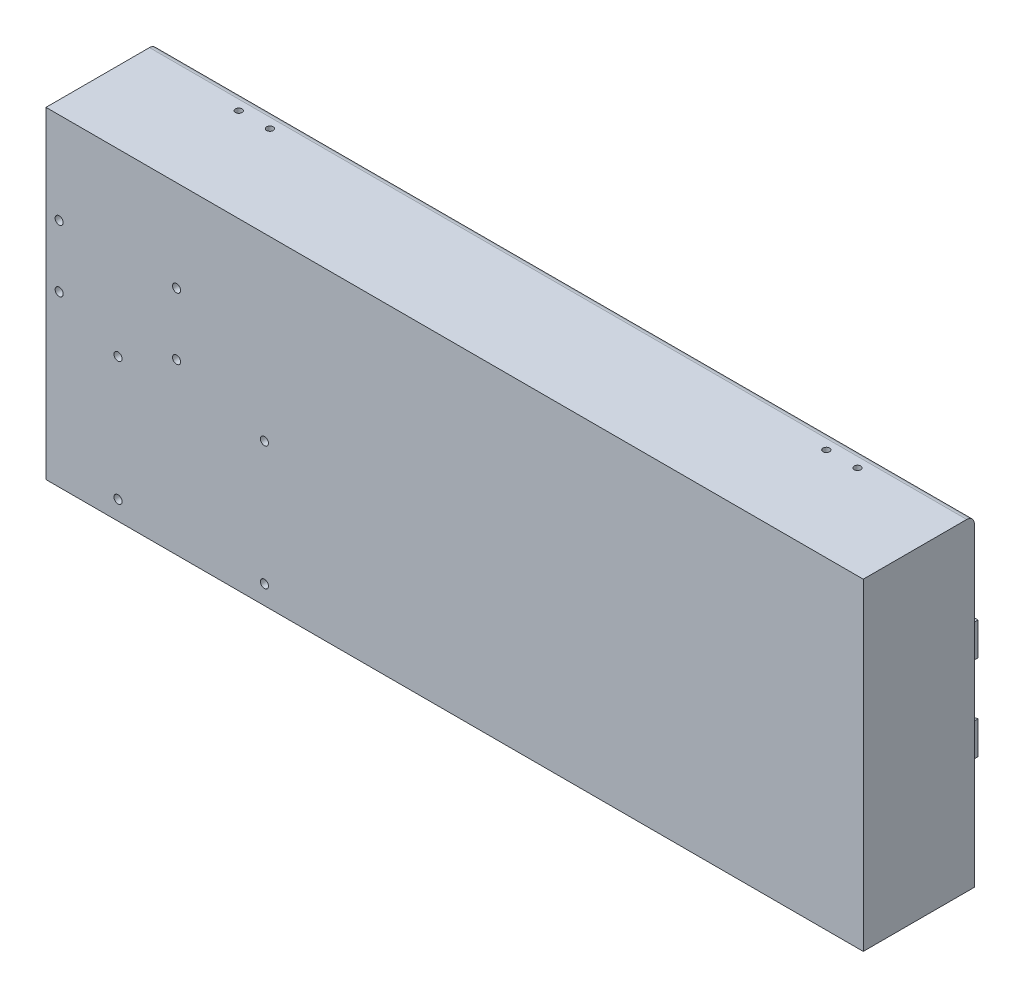
from build123d import *

# Parameters (mm, degrees)
SKETCH1_W               = 323.749339931
SKETCH1_H               = 127.712624425
BOSS_EXTRUDE1_DEPTH     = 4
SKETCH3_W               = 323.749339931
SKETCH3_H               = 127.712624425
SKETCH3_W_2             = 317.749339931
SKETCH3_H_2             = 121.712624425
BOSS_EXTRUDE2_DEPTH     = 40
BOSS_EXTRUDE4_DEPTH     = 23
MIRROR2_START           = -46
MIRROR2_DEPTH           = 46
SKETCH6_W               = 7
SKETCH6_H               = 7
SKETCH6_W_2             = 7.037117603
BOSS_EXTRUDE5_DEPTH     = 15
CUT_EXTRUDE1_DEPTH      = 384.171889741
CUT_EXTRUDE1_DEPTH_BACK = 384.171889741
SKETCH8_R               = 1.6
SKETCH15_W              = 16
SKETCH15_H              = 15.6321
SKETCH15_H_2            = 15.2842
SKETCH15_W_2            = 13.5
SKETCH15_H_3            = 15.875
CUT_EXTRUDE3_DEPTH      = 10
SKETCH20_W              = 6.961581082
SKETCH20_H              = 6.395810998
SKETCH20_W_2            = 15.273499614
SKETCH20_H_2            = 7.259028395
CUT_EXTRUDE5_DEPTH      = 15
SKETCH22_W              = 4
SKETCH22_H              = 4
BOSS_EXTRUDE7_DEPTH     = 15
CUT_EXTRUDE6_DEPTH      = 384.171889741
CUT_EXTRUDE6_DEPTH_BACK = 384.171889741
SKETCH23_R              = 1.6
SKETCH26_W              = 3.282490876
SKETCH26_H              = 7.57632074
CUT_EXTRUDE7_DEPTH      = 15
CUT_EXTRUDE9_DEPTH      = 384.171889741
CUT_EXTRUDE9_DEPTH_BACK = 10
SKETCH31_R              = 1.55
SKETCH35_R              = 1.29987
CUT_EXTRUDE10_DEPTH     = 6
FILLET1_R               = 3


# Read off the part's stored shape, not the designer's step: Mirror2
with BuildPart() as part:
    # Sketch1 → Boss-Extrude1 (new body)
    with BuildSketch(Plane.XY):
        with Locations((-196.446669966, 63.856312213)):
            Rectangle(SKETCH1_W, SKETCH1_H)
    extrude(amount=BOSS_EXTRUDE1_DEPTH)

    # Sketch3 → Boss-Extrude2 (add)
    with BuildSketch(Plane(origin=(0, 0, 0), x_dir=(-1, 0, 0), z_dir=(0, 0, -1))):
        with Locations((196.446669966, 63.856312213)):
            Rectangle(SKETCH3_W, SKETCH3_H)
        with Locations((196.446669966, 63.856312213)):
            Rectangle(SKETCH3_W_2, SKETCH3_H_2, mode=Mode.SUBTRACT)
    extrude(amount=BOSS_EXTRUDE2_DEPTH)

    # Sketch5 → Boss-Extrude4 (add)
    with BuildSketch(Plane(origin=(0, 0, 0), x_dir=(-1, 0, 0), z_dir=(0, 0, -1))):
        with BuildLine():
            Line((55.615, 15.55), (57.315, 15.55))
            Line((57.315, 15.55), (122.07188805, 15.55))
            Line((122.07188805, 15.55), (123.77188805, 15.55))
            Line((123.77188805, 15.55), (123.77188805, 39.55))
            Line((123.77188805, 39.55), (144.272, 39.55))
            Line((144.272, 39.55), (144.272, 52.55))
            ThreePointArc((144.272, 52.55), (118.055062242, 48.579333299), (91.572, 47.259699375))
            ThreePointArc((91.572, 47.259699375), (65.214565819, 48.591848157), (39.122, 52.55))
            Line((39.122, 52.55), (39.122, 39.55))
            Line((39.122, 39.55), (55.615, 39.55))
            Line((55.615, 39.55), (55.615, 15.55))
        make_face()
        with BuildLine():
            Line((122.07188805, 41.25), (122.07188805, 17.25))
            Line((122.07188805, 17.25), (57.315, 17.25))
            Line((57.315, 17.25), (57.315, 18.497962217))
            Line((57.315, 18.497962217), (57.315, 41.25))
            Line((57.315, 41.25), (40.822, 41.25))
            Line((40.822, 41.25), (40.822, 48.791098857))
            Line((40.822, 48.791098857), (40.822, 49.651849125))
            Line((40.822, 49.651849125), (40.822, 50.881098857))
            ThreePointArc((40.822, 50.881098857), (91.696923028, 45.880454534), (142.572, 50.879532423))
            Line((142.572, 50.879532423), (142.572, 48.791100773))
            Line((142.572, 48.791100773), (142.572, 42))
            Line((142.572, 42), (142.572, 41.25))
            Line((142.572, 41.25), (122.07188805, 41.25))
        make_face(mode=Mode.SUBTRACT)
    boss_extrude4 = extrude(amount=BOSS_EXTRUDE4_DEPTH)

    # Mirror1: Boss-Extrude4 across plane
    add(boss_extrude4.mirror(Plane.ZY.offset(149.272)))

    # Mirror2 outline → Mirror2 (add)
    # profile 1 of 4: a face of its own
    with BuildSketch(Plane.XY.offset(MIRROR2_START)):
        with BuildLine():
            Line((-144.272, 52.55), (-144.272, 39.55))
            Line((-144.272, 39.55), (-123.77188805, 39.55))
            Line((-123.77188805, 39.55), (-123.77188805, 15.55))
            Line((-123.77188805, 15.55), (-55.615, 15.55))
            Line((-55.615, 15.55), (-55.615, 39.55))
            Line((-55.615, 39.55), (-39.122, 39.55))
            Line((-39.122, 39.55), (-39.122, 52.55))
            ThreePointArc((-39.122, 52.55), (-91.697, 47.25966977), (-144.272, 52.55))
        make_face()
        with BuildLine():
            Line((-40.822, 41.25), (-57.315, 41.25))
            Line((-57.315, 41.25), (-57.315, 17.25))
            Line((-57.315, 17.25), (-122.07188805, 17.25))
            Line((-122.07188805, 17.25), (-122.07188805, 41.25))
            Line((-122.07188805, 41.25), (-142.572, 41.25))
            Line((-142.572, 41.25), (-142.572, 50.879532423))
            ThreePointArc((-142.572, 50.879532423), (-91.696923027, 45.880454534), (-40.822, 50.881098857))
            Line((-40.822, 50.881098857), (-40.822, 41.25))
        make_face(mode=Mode.SUBTRACT)
    # profile 2 of 4: a face of its own
    with BuildSketch(Plane.XY.offset(MIRROR2_START)):
        with BuildLine():
            Line((-123.77188805, 86.45), (-144.272, 86.45))
            Line((-144.272, 86.45), (-144.272, 73.45))
            ThreePointArc((-144.272, 73.45), (-91.697, 78.74033023), (-39.122, 73.45))
            Line((-39.122, 73.45), (-39.122, 86.45))
            Line((-39.122, 86.45), (-55.615, 86.45))
            Line((-55.615, 86.45), (-55.615, 110.45))
            Line((-55.615, 110.45), (-123.77188805, 110.45))
            Line((-123.77188805, 110.45), (-123.77188805, 86.45))
        make_face()
        with BuildLine():
            Line((-142.572, 75.120467577), (-142.572, 84.75))
            Line((-142.572, 84.75), (-122.07188805, 84.75))
            Line((-122.07188805, 84.75), (-122.07188805, 108.75))
            Line((-122.07188805, 108.75), (-57.315, 108.75))
            Line((-57.315, 108.75), (-57.315, 84.75))
            Line((-57.315, 84.75), (-40.822, 84.75))
            Line((-40.822, 84.75), (-40.822, 75.118901143))
            ThreePointArc((-40.822, 75.118901143), (-91.696923027, 80.119545466), (-142.572, 75.120467577))
        make_face(mode=Mode.SUBTRACT)
    # profile 3 of 4: a face of its own
    with BuildSketch(Plane.XY.offset(MIRROR2_START)):
        with BuildLine():
            Line((-174.77211195, 15.55), (-174.77211195, 39.55))
            Line((-174.77211195, 39.55), (-154.272, 39.55))
            Line((-154.272, 39.55), (-154.272, 52.55))
            ThreePointArc((-154.272, 52.55), (-206.847, 47.25966977), (-259.422, 52.55))
            Line((-259.422, 52.55), (-259.422, 39.55))
            Line((-259.422, 39.55), (-242.929, 39.55))
            Line((-242.929, 39.55), (-242.929, 15.55))
            Line((-242.929, 15.55), (-174.77211195, 15.55))
        make_face()
        with BuildLine():
            Line((-257.722, 41.25), (-257.722, 50.881098857))
            ThreePointArc((-257.722, 50.881098857), (-206.847076973, 45.880454534), (-155.972, 50.879532423))
            Line((-155.972, 50.879532423), (-155.972, 41.25))
            Line((-155.972, 41.25), (-176.47211195, 41.25))
            Line((-176.47211195, 41.25), (-176.47211195, 17.25))
            Line((-176.47211195, 17.25), (-241.229, 17.25))
            Line((-241.229, 17.25), (-241.229, 41.25))
            Line((-241.229, 41.25), (-257.722, 41.25))
        make_face(mode=Mode.SUBTRACT)
    # profile 4 of 4: a face of its own
    with BuildSketch(Plane.XY.offset(MIRROR2_START)):
        with BuildLine():
            Line((-154.272, 73.45), (-154.272, 86.45))
            Line((-154.272, 86.45), (-174.77211195, 86.45))
            Line((-174.77211195, 86.45), (-174.77211195, 110.45))
            Line((-174.77211195, 110.45), (-242.929, 110.45))
            Line((-242.929, 110.45), (-242.929, 86.45))
            Line((-242.929, 86.45), (-259.422, 86.45))
            Line((-259.422, 86.45), (-259.422, 73.45))
            ThreePointArc((-259.422, 73.45), (-206.847, 78.74033023), (-154.272, 73.45))
        make_face()
        with BuildLine():
            Line((-155.972, 84.75), (-155.972, 75.120467577))
            ThreePointArc((-155.972, 75.120467577), (-206.847076973, 80.119545466), (-257.722, 75.118901143))
            Line((-257.722, 75.118901143), (-257.722, 84.75))
            Line((-257.722, 84.75), (-241.229, 84.75))
            Line((-241.229, 84.75), (-241.229, 108.75))
            Line((-241.229, 108.75), (-176.47211195, 108.75))
            Line((-176.47211195, 108.75), (-176.47211195, 84.75))
            Line((-176.47211195, 84.75), (-155.972, 84.75))
        make_face(mode=Mode.SUBTRACT)
    extrude(amount=MIRROR2_DEPTH)

    # Sketch6 → Boss-Extrude5 (add)
    with BuildSketch(Plane(origin=(0, 0, 0), x_dir=(-1, 0, 0), z_dir=(0, 0, -1))):
        with Locations((271.792612115, 56.4935)):
            Rectangle(SKETCH6_W, SKETCH6_H)
        with Locations((329.792612115, 56.4935)):
            Rectangle(SKETCH6_W, SKETCH6_H)
        with Locations((329.792612115, 7.4935)):
            Rectangle(SKETCH6_W_2, SKETCH6_H)
        with Locations((271.792612115, 7.4935)):
            Rectangle(SKETCH6_W, SKETCH6_H)
    extrude(amount=BOSS_EXTRUDE5_DEPTH)

    # Sketch8 → Cut-Extrude1 (cut, two sides: drawn at the far end of the back side and taken through both)
    with BuildSketch(Plane(origin=(0, 0, 0), x_dir=(-1, 0, 0), z_dir=(0, 0, -1)).offset(-CUT_EXTRUDE1_DEPTH_BACK)):
        with Locations(Location((329.792612115, 56.4935, 0), (0, 0, 180))):
            Circle(SKETCH8_R)
        with Locations((329.792612115, 7.4935)):
            Circle(SKETCH8_R)
        with Locations((271.792612115, 7.4935)):
            Circle(SKETCH8_R)
        with Locations(Location((271.792612115, 56.4935, 0), (0, 0, 180))):
            Circle(SKETCH8_R)
    extrude(amount=CUT_EXTRUDE1_DEPTH + CUT_EXTRUDE1_DEPTH_BACK, mode=Mode.SUBTRACT)

    # Sketch15 → Cut-Extrude3 (cut)
    with BuildSketch(Plane.ZY.offset(358.321339931)):
        with Locations((-23.0254, 50.81955)):
            Rectangle(SKETCH15_W, SKETCH15_H)
        with Locations((-23.0254, 32.9935)):
            Rectangle(SKETCH15_W, SKETCH15_H_2)
        with Locations((-21.7754, 14.2435)):
            Rectangle(SKETCH15_W_2, SKETCH15_H_3)
    extrude(amount=-CUT_EXTRUDE3_DEPTH, mode=Mode.SUBTRACT)

    # Sketch20 → Cut-Extrude5 (cut)
    with BuildSketch(Plane.XZ):
        with Locations((-321.715421574, -18.223305499)):
            Rectangle(SKETCH20_W, SKETCH20_H)
        with Locations((-300.141868021, -18.680314197)):
            Rectangle(SKETCH20_W_2, SKETCH20_H_2)
    extrude(amount=-CUT_EXTRUDE5_DEPTH, mode=Mode.SUBTRACT)

    # Sketch22 → Boss-Extrude7 (add)
    with BuildSketch(Plane(origin=(0, 0, 0), x_dir=(-1, 0, 0), z_dir=(0, 0, -1))):
        with Locations((306.606527112, 91.535834427)):
            Rectangle(SKETCH22_W, SKETCH22_H)
        with Locations((353.106527112, 91.535834427)):
            Rectangle(SKETCH22_W, SKETCH22_H)
        with Locations((353.106527112, 67.035834427)):
            Rectangle(SKETCH22_W, SKETCH22_H)
        with Locations((306.606527112, 67.035834427)):
            Rectangle(SKETCH22_W, SKETCH22_H)
    extrude(amount=BOSS_EXTRUDE7_DEPTH)

    # Sketch23 → Cut-Extrude6 (cut, two sides: drawn at the far end of the back side and taken through both)
    with BuildSketch(Plane(origin=(0, 0, 0), x_dir=(-1, 0, 0), z_dir=(0, 0, -1)).offset(-CUT_EXTRUDE6_DEPTH_BACK)):
        with Locations((306.606527112, 91.535834427)):
            Circle(SKETCH23_R)
        with Locations((353.106527112, 91.535834427)):
            Circle(SKETCH23_R)
        with Locations((306.606527112, 67.035834427)):
            Circle(SKETCH23_R)
        with Locations((353.106527112, 67.035834427)):
            Circle(SKETCH23_R)
    extrude(amount=CUT_EXTRUDE6_DEPTH + CUT_EXTRUDE6_DEPTH_BACK, mode=Mode.SUBTRACT)

    # Sketch26 → Cut-Extrude7 (cut)
    with BuildSketch(Plane.ZY.offset(358.321339931)):
        with Locations((-17.758754562, 80.583173789)):
            Rectangle(SKETCH26_W, SKETCH26_H)
    extrude(amount=-CUT_EXTRUDE7_DEPTH, mode=Mode.SUBTRACT)

    # Sketch31 → Cut-Extrude9 (cut, two sides: drawn at the far end of the back side and taken through both)
    with BuildSketch(Plane.XZ.offset(-CUT_EXTRUDE9_DEPTH_BACK)):
        with Locations(Location((-207.946669965, -33.5, 0), (0, 0, 90))):
            Circle(SKETCH31_R)
        with Locations(Location((-184.946669965, -33.5, 0), (0, 0, 90))):
            Circle(SKETCH31_R)
    extrude(amount=CUT_EXTRUDE9_DEPTH + CUT_EXTRUDE9_DEPTH_BACK, mode=Mode.SUBTRACT)

    # Sketch35 → Cut-Extrude10 (cut)
    with BuildSketch(Plane(origin=(-336.564783674, 127.712624425, -265.469665729), x_dir=(1, 0, 0), z_dir=(0, 1, 0))):
        with Locations(Location((17.576343743, -232.436520439, 0), (0, 0, 270))):
            Circle(SKETCH35_R)
        with Locations(Location((29.908443743, -232.436520439, 0), (0, 0, 270))):
            Circle(SKETCH35_R)
        with Locations(Location((262.659883674, -232.436520439, 0), (0, 0, 270))):
            Circle(SKETCH35_R)
        with Locations(Location((250.327783674, -232.436520439, 0), (0, 0, 270))):
            Circle(SKETCH35_R)
    extrude(amount=-CUT_EXTRUDE10_DEPTH, mode=Mode.SUBTRACT)

    # Fillet1
    fillet1_edges = [part.edges().sort_by_distance(p)[0] for p in [
        (-196.446669965, 127.712624425, -40),
    ]]
    fillet(fillet1_edges, radius=FILLET1_R - 0.0001)  # a hair under: the kernel refuses the full size


solid = part.part
